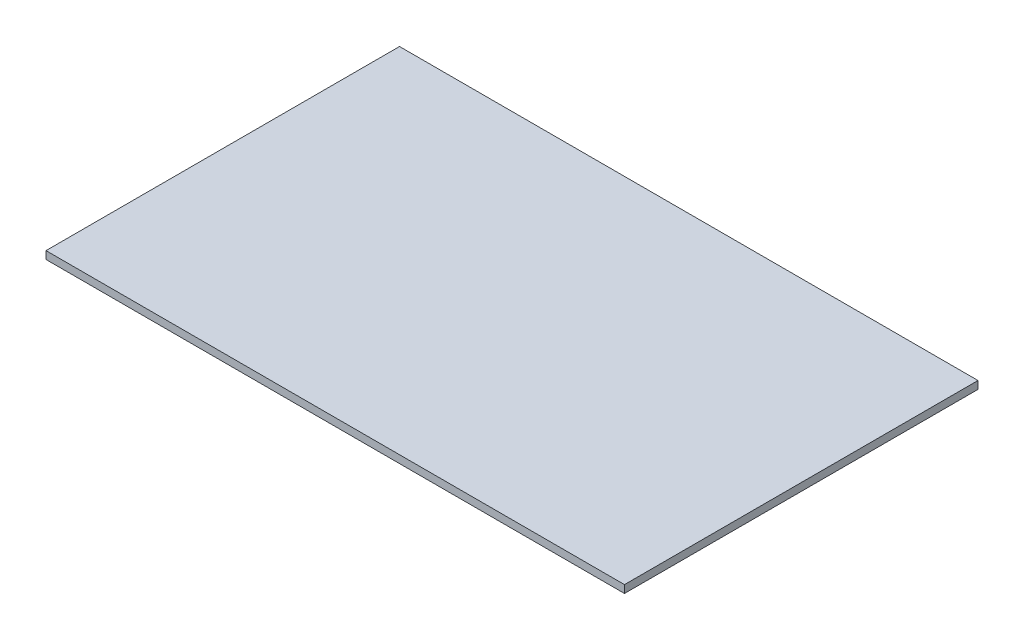
from build123d import *

# Parameters (mm, degrees)
SKETCH2_W           = 450
SKETCH2_H           = 275
BOSS_EXTRUDE1_DEPTH = 6


with BuildPart() as part:
    # Sketch2 → Boss-Extrude1 (new body)
    with BuildSketch(Plane(origin=(0, 0, 0), x_dir=(1, 0, 0), z_dir=(0, 1, 0))):
        with Locations((225, 137.5)):
            Rectangle(SKETCH2_W, SKETCH2_H)
    extrude(amount=BOSS_EXTRUDE1_DEPTH)


solid = part.part
